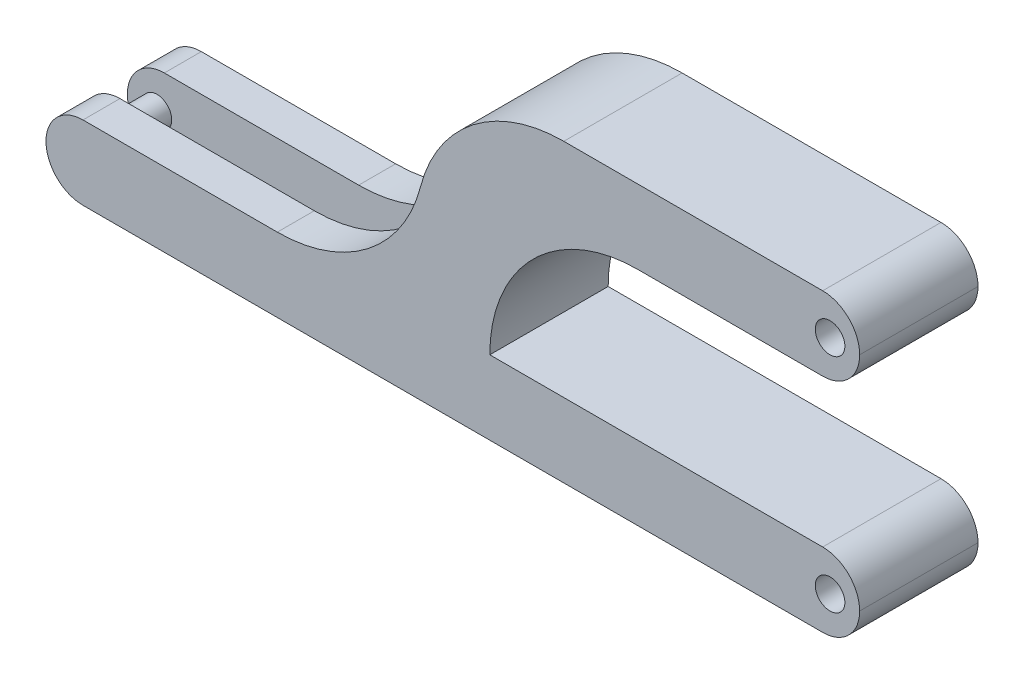
from build123d import *

# Parameters (mm, degrees)
SKETCH1_R           = 2
BOSS_EXTRUDE1_DEPTH = 8
SKETCH2_W           = 5
SKETCH2_H           = 10
BOSS_EXTRUDE2_DEPTH = 50
SKETCH3_R           = 2
BOSS_EXTRUDE3_DEPTH = 5
FILLET1_R           = 20
FILLET2_R           = 20
FILLET3_R           = 20
FILLET4_R           = 5


# Some blends are built 0.0001 mm under size
with BuildPart() as part:
    # Sketch1 → Boss-Extrude1 (new body)
    with BuildSketch(Plane.XY):
        Polygon((60, 20), (0, 20), (0, 0), (0, -20), (60, -20), (60, -10), (10, -10), (10, 0), (10, 10), (60, 10), align=None)
        with Locations((56, 15)):
            Circle(SKETCH1_R, mode=Mode.SUBTRACT)
        with Locations((56, -15)):
            Circle(SKETCH1_R, mode=Mode.SUBTRACT)
    boss_extrude1 = extrude(amount=BOSS_EXTRUDE1_DEPTH)

    # Sketch2 → Boss-Extrude2 (add)
    with BuildSketch(Plane.ZY):
        with Locations((5.5, -15)):
            Rectangle(SKETCH2_W, SKETCH2_H)
    boss_extrude2 = extrude(amount=BOSS_EXTRUDE2_DEPTH)

    # Sketch3 → Boss-Extrude3 (add)
    with BuildSketch(Plane(origin=(0, 0, 3), x_dir=(-1, 0, 0), z_dir=(0, 0, -1))):
        with Locations(Location((46, -15, 0), (0, 0, 270))):
            Circle(SKETCH3_R)
    boss_extrude3 = extrude(amount=BOSS_EXTRUDE3_DEPTH)

    # Mirror1: Boss-Extrude1, Boss-Extrude2, Boss-Extrude3 across plane
    add(boss_extrude1.mirror(Plane.XY))
    add(boss_extrude2.mirror(Plane.XY))
    add(boss_extrude3.mirror(Plane.XY))

    # Fillet1
    fillet1_edges = [part.edges().sort_by_distance(p)[0] for p in [
        (10, 10, 0),
    ]]
    fillet(fillet1_edges, radius=FILLET1_R - 0.0001)  # a hair under: the kernel refuses the full size

    # Fillet2
    fillet2_edges = [part.edges().sort_by_distance(p)[0] for p in [
        (0, 20, 0),
    ]]
    fillet(fillet2_edges, radius=FILLET2_R)

    # Fillet3
    # the kernel refuses this fillet: 20 mm, written as the material it adds along each edge
    with BuildSketch(Plane(origin=(0, -10, -43.824583655), x_dir=(0.042300987596812424, 0.9991049126334702, 0), z_dir=(0, 0, 1))) as fillet3_piece_1_section:
        with BuildLine():
            CenterArc((19.1898078, 19.559088377), FILLET3_R, 182.424391449, 75.522487814)
            Line((-0.792290453, 18.713068625), (-2.790500278, 18.62846665))
            Line((-2.790500278, 18.62846665), (-1.998209825, -0.084601975))
            Line((-1.998209825, -0.084601975), (0.084601975, -1.998209825))
            ThreePointArc((0.084601975, -1.998209825), (10.075651102, -1.575199949), (14.595801393, -1.955908838))
            Line((14.595801393, -1.955908838), (15.013438339, 0))
        make_face()
    fillet3_piece_1 = extrude(amount=98.64916731, mode=Mode.PRIVATE)
    fillet3_piece_1 = split(fillet3_piece_1, bisect_by=Plane(origin=(-6.457889851, -5.843011077, -8), z_dir=(0, 0, 1)), keep=Keep.TOP, mode=Mode.PRIVATE)
    fillet3_piece_1 = split(fillet3_piece_1, bisect_by=Plane(origin=(-6.457889851, -5.843011077, -3), z_dir=(0, 0, -1)), keep=Keep.TOP, mode=Mode.PRIVATE)
    add(fillet3_piece_1)
    with BuildSketch(Plane(origin=(0, -10, 3), x_dir=(0.042300987596807504, 0.9991049126334706, 0), z_dir=(0, 0, 1))) as fillet3_piece_2:
        with BuildLine():
            CenterArc((19.1898078, 19.559088377), FILLET3_R, 182.424391449, 75.522487814)
            Line((-0.792290453, 18.713068625), (-2.790500278, 18.62846665))
            Line((-2.790500278, 18.62846665), (-1.998209825, -0.084601975))
            Line((-1.998209825, -0.084601975), (0.084601975, -1.998209825))
            ThreePointArc((0.084601975, -1.998209825), (10.075651102, -1.575199949), (14.595801393, -1.955908838))
            Line((14.595801393, -1.955908838), (15.013438339, 0))
        make_face()
    extrude(amount=5)
    with BuildSketch(Plane(origin=(0, -10, 43.824583655), x_dir=(0.042300987596812424, 0.9991049126334702, 0), z_dir=(0, 0, -1))) as fillet3_piece_3_section:
        with BuildLine():
            CenterArc((19.1898078, -19.559088377), FILLET3_R, 102.053120737, 75.522487814)
            Line((-0.792290453, -18.713068625), (-2.790500278, -18.62846665))
            Line((-2.790500278, -18.62846665), (-1.998209825, 0.084601975))
            Line((-1.998209825, 0.084601975), (0.084601975, 1.998209825))
            ThreePointArc((0.084601975, 1.998209825), (10.075651102, 1.575199949), (14.595801393, 1.955908838))
            Line((14.595801393, 1.955908838), (15.013438339, 0))
        make_face()
    fillet3_piece_3 = extrude(amount=98.64916731, mode=Mode.PRIVATE)
    fillet3_piece_3 = split(fillet3_piece_3, bisect_by=Plane(origin=(-6.457889851, -5.843011077, 8), z_dir=(0, 0, -1)), keep=Keep.TOP, mode=Mode.PRIVATE)
    fillet3_piece_3 = split(fillet3_piece_3, bisect_by=Plane(origin=(-6.457889851, -5.843011077, 3), z_dir=(0, 0, 1)), keep=Keep.TOP, mode=Mode.PRIVATE)
    add(fillet3_piece_3)
    with BuildSketch(Plane(origin=(0, -10, -3), x_dir=(0.042300987596807504, 0.9991049126334706, 0), z_dir=(0, 0, -1))) as fillet3_piece_4:
        with BuildLine():
            CenterArc((19.1898078, -19.559088377), FILLET3_R, 102.053120737, 75.522487814)
            Line((-0.792290453, -18.713068625), (-2.790500278, -18.62846665))
            Line((-2.790500278, -18.62846665), (-1.998209825, 0.084601975))
            Line((-1.998209825, 0.084601975), (0.084601975, 1.998209825))
            ThreePointArc((0.084601975, 1.998209825), (10.075651102, 1.575199949), (14.595801393, 1.955908838))
            Line((14.595801393, 1.955908838), (15.013438339, 0))
        make_face()
    extrude(amount=5)
    # the kernel refuses this fillet: 20 mm, written as the material it takes off along each edge

    # Fillet4
    # the kernel refuses this fillet: 5 mm, written as the material it takes off along each edge
    with BuildSketch(Plane(origin=(60, 10, 20.5), x_dir=(0, 1, 0), z_dir=(0, 0, -1)), Plane(origin=(60, 20, 20.5), x_dir=(-1, 0, 0), z_dir=(0, 0, -1))) as fillet4_piece_1:
        with BuildLine():
            CenterArc((FILLET4_R, -FILLET4_R), FILLET4_R, 90, 90)
            Line((0, -FILLET4_R), (0, 0))
            Line((0, 0), (FILLET4_R, 0))
        make_face()
    extrude(amount=41, mode=Mode.SUBTRACT)
    with BuildSketch(Plane(origin=(60, -10, -20.5), x_dir=(-1, 0, 0), z_dir=(0, 0, 1)), Plane(origin=(60, -20, -20.5), x_dir=(0, 1, 0), z_dir=(0, 0, 1))) as fillet4_piece_2:
        with BuildLine():
            CenterArc((FILLET4_R, FILLET4_R), FILLET4_R, 180, 90)
            Line((0, FILLET4_R), (0, 0))
            Line((0, 0), (FILLET4_R, 0))
        make_face()
    extrude(amount=41, mode=Mode.SUBTRACT)
    with BuildSketch(Plane(origin=(-50, -10, -9.5), x_dir=(1, 0, 0), z_dir=(0, 0, 1)), Plane(origin=(-50, -10, 9.5), x_dir=(0, -1, 0), z_dir=(0, 0, -1))) as fillet4_piece_3:
        with BuildLine():
            CenterArc((FILLET4_R, -FILLET4_R), FILLET4_R, 90, 90)
            Line((0, -FILLET4_R), (0, 0))
            Line((0, 0), (FILLET4_R, 0))
        make_face()
    extrude(amount=30, mode=Mode.SUBTRACT)
    with BuildSketch(Plane(origin=(-50, -20, 20.5), x_dir=(0, 1, 0), z_dir=(0, 0, -1)), Plane(origin=(-50, -20, -20.5), x_dir=(1, 0, 0), z_dir=(0, 0, 1))) as fillet4_piece_4:
        with BuildLine():
            CenterArc((FILLET4_R, FILLET4_R), FILLET4_R, 180, 90)
            Line((0, FILLET4_R), (0, 0))
            Line((0, 0), (FILLET4_R, 0))
        make_face()
    extrude(amount=30, mode=Mode.SUBTRACT)


solid = part.part
